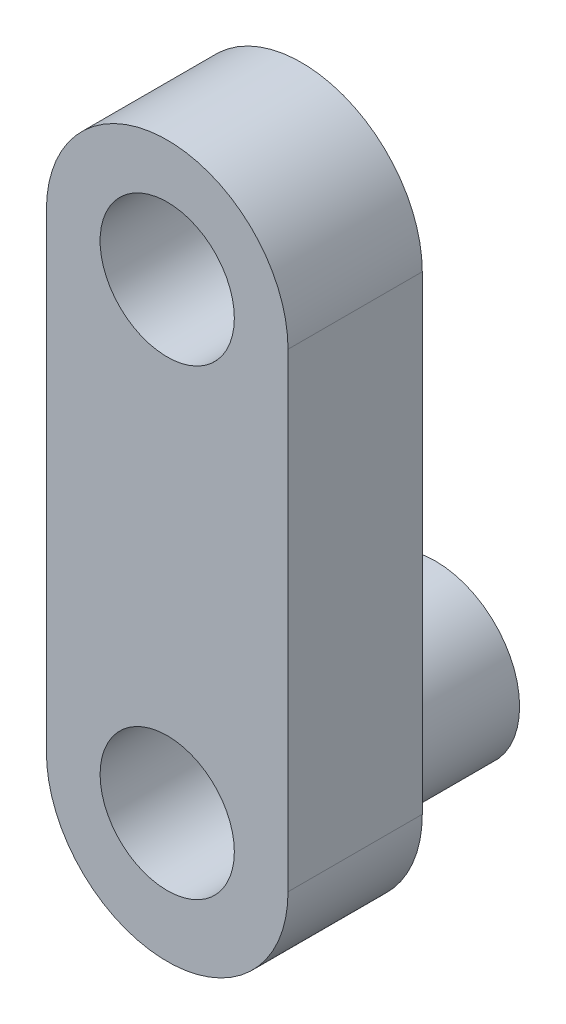
from build123d import *
from build123d.topology import SkipClean

# Parameters (mm, degrees)
SKETCH_1_R      = 10
EXTRUDE_1_DEPTH = 10
EXTRUDE_START   = 20
SKETCH_3_R      = 12.5
SKETCH_3_R_2    = 10
EXTRUDE_2_DEPTH = 20


with BuildPart() as part:
    # Эскиз1 → Бобышка-Вытянуть1 (new, symmetric)
    with BuildSketch(Plane.XY):
        with BuildLine():
            Line((18, 70), (18, 0))
            ThreePointArc((18, 0), (0, -18), (-18, 0))
            Line((-18, 0), (-18, 70))
            ThreePointArc((-18, 70), (0, 88), (18, 70))
        make_face()
        with Locations((0, 1.153846154)):
            Circle(SKETCH_1_R, mode=Mode.SUBTRACT)
        with Locations((0, 70)):
            Circle(SKETCH_1_R, mode=Mode.SUBTRACT)
    extrude(amount=EXTRUDE_1_DEPTH, both=True)

    # Эскиз3 → Бобышка-Вытянуть2 (add)
    with SkipClean():  # the faces are left unmerged after this step: merging them gives an invalid solid
        with BuildSketch(Plane(origin=(0, 0, -10), x_dir=(-1, 0, 0), z_dir=(0, 0, -1)).offset(EXTRUDE_START)):
            with Locations((0, 1.153846154)):
                Circle(SKETCH_3_R)
            with Locations((0, 1.153846154)):
                Circle(SKETCH_3_R_2, mode=Mode.SUBTRACT)
        extrude(amount=-EXTRUDE_2_DEPTH)


solid = part.part
